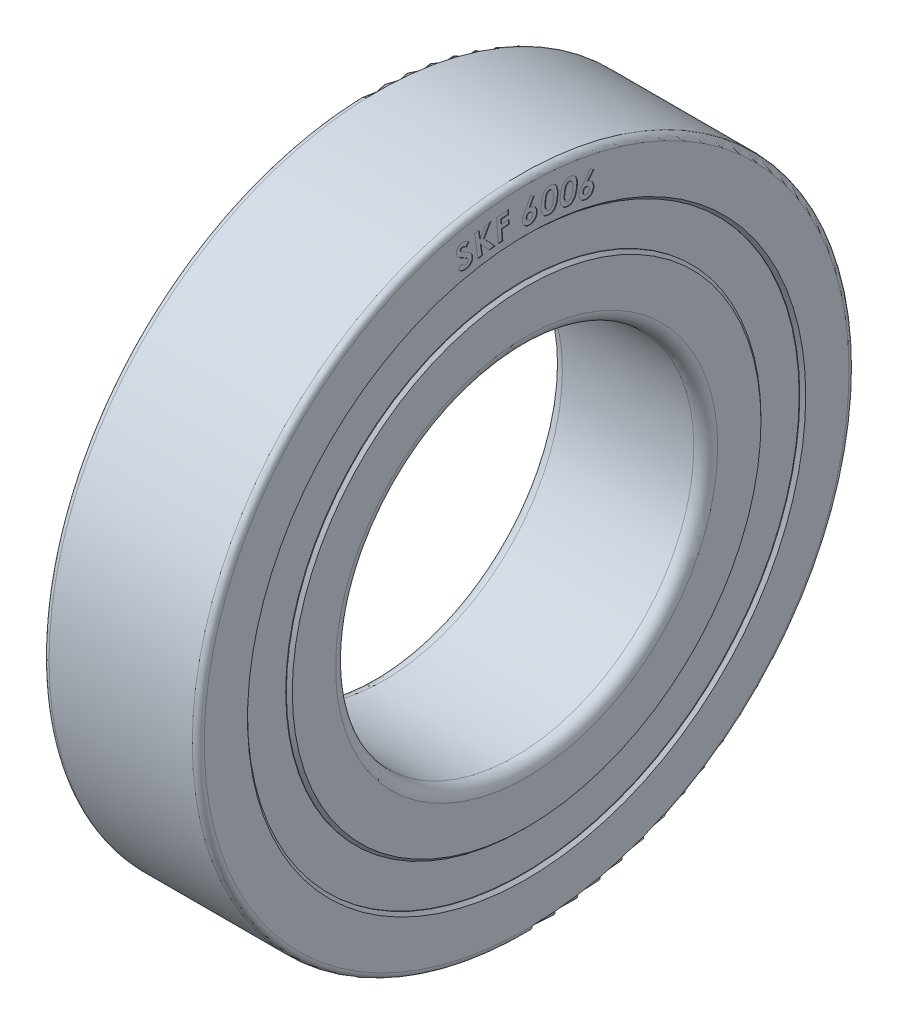
from build123d import *

# Parameters (mm, degrees)
CIRPATTERN1_COUNT = 12
WRAP1_START       = -0.05
WRAP1_DEPTH       = 0.05
SEAL_START        = 0.2
SKETCH4_R         = 23.125
SKETCH4_R_2       = 19.875
SEAL_1_DEPTH      = 0.2
SKETCH5_R         = 23.125
SKETCH5_R_2       = 19.875
SEAL_2_DEPTH      = 0.2


# Read off the part's stored shape, not the designer's step: Wrap1
with BuildPart() as part:
    # Sketch1 → Revolve1 (revolve)
    with BuildSketch(Plane.XY, mode=Mode.PRIVATE) as revolve1_sk:
        with BuildLine():
            Line((-12.75, 23.125), (-9.314582562, 23.125))
            ThreePointArc((-9.314582562, 23.125), (-6.5, 24.75), (-3.685417438, 23.125))
            Line((-3.685417438, 23.125), (-0.25, 23.125))
            Line((-0.25, 23.125), (0, 23.375))
            Line((0, 23.375), (0, 27))
            ThreePointArc((0, 27), (-0.146446609, 27.353553391), (-0.5, 27.5))
            Line((-0.5, 27.5), (-12.5, 27.5))
            ThreePointArc((-12.5, 27.5), (-12.853553391, 27.353553391), (-13, 27))
            Line((-13, 27), (-13, 23.375))
            Line((-13, 23.375), (-12.75, 23.125))
        make_face()
        with BuildLine():
            Line((-1, 15), (-12, 15))
            ThreePointArc((-12, 15), (-12.707106781, 15.292893219), (-13, 16))
            Line((-13, 16), (-13, 19.625))
            Line((-13, 19.625), (-12.75, 19.875))
            Line((-12.75, 19.875), (-9.314582562, 19.875))
            ThreePointArc((-9.314582562, 19.875), (-6.5, 18.25), (-3.685417438, 19.875))
            Line((-3.685417438, 19.875), (-0.25, 19.875))
            Line((-0.25, 19.875), (0, 19.625))
            Line((0, 19.625), (0, 16))
            ThreePointArc((0, 16), (-0.292893219, 15.292893219), (-1, 15))
        make_face()
    revolve(revolve1_sk.sketch.rotate(Axis((0, 0, 0), (-1, 0, 0)), 90), axis=Axis((0, 0, 0), (-1, 0, 0)))

    # Wrap1 outline → Wrap1 (cut)
    # profile 1 of 7: a face of its own
    with BuildSketch(Plane(origin=(0, 0, 0), x_dir=(0, 0, -1), z_dir=(1, 0, 0)).offset(WRAP1_START)):
        with BuildLine():
            add(Edge.make_bspline(
                [(5.156809449, 24.659470412), (5.176945196, 24.654630794), (5.216683196, 24.645079783), (5.273800642, 24.624532867), (5.327450546, 24.598685113), (5.377759061, 24.567953052), (5.423984453, 24.531360521), (5.467223707, 24.490457336), (5.506410953, 24.443954592), (5.542252088, 24.393541534), (5.573452736, 24.339721566), (5.598815277, 24.28364258), (5.617639321, 24.225802632), (5.631050214, 24.166681366), (5.638232871, 24.105853018), (5.639305794, 24.043477002), (5.634661519, 23.979452048), (5.626770551, 23.936789619), (5.622754962, 23.915079386)],
                knots=[0, 0, 0, 0, 0.06343411, 0.125187547, 0.185597165, 0.245685648, 0.305454076, 0.365957902, 0.427798083, 0.491506241, 0.55531949, 0.618153949, 0.679762089, 0.741424585, 0.803664384, 0.867115656, 0.932377267, 1, 1, 1, 1], degree=3))
            Line((5.156809449, 24.659470412), (5.636376757, 25.251617848))
            Line((5.636376757, 25.251617848), (5.353524193, 25.475576181))
            Line((5.353524193, 25.475576181), (4.646793424, 24.598172335))
            add(Edge.make_bspline(
                [(4.397194065, 24.167082591), (4.400716348, 24.182097626), (4.407769889, 24.212165952), (4.422364141, 24.256521919), (4.440632528, 24.300138418), (4.45817215, 24.33682558), (4.47581412, 24.366786938), (4.491471624, 24.392324213), (4.510451493, 24.42020006), (4.531989099, 24.450988806), (4.556419601, 24.484366968), (4.584319892, 24.519759583), (4.614127836, 24.558491206), (4.635631027, 24.584612606), (4.646793424, 24.598172335)],
                knots=[0, 0, 0, 0, 0.091866481, 0.183967018, 0.277804361, 0.373535642, 0.42594627, 0.484906716, 0.551999969, 0.626838199, 0.708803923, 0.798416397, 0.895357102, 1, 1, 1, 1], degree=3))
            add(Edge.make_bspline(
                [(4.886376757, 23.433108232), (4.86488432, 23.438149392), (4.82264709, 23.448056347), (4.762407125, 23.470117986), (4.705685758, 23.496483464), (4.653259679, 23.528628145), (4.604570018, 23.565864438), (4.560136337, 23.608351446), (4.519823014, 23.65618398), (4.483747718, 23.70810392), (4.452810851, 23.763110073), (4.426985014, 23.819182641), (4.407095886, 23.876035027), (4.393583518, 23.933406141), (4.385411928, 23.991211963), (4.383009383, 24.049445445), (4.38642109, 24.108436288), (4.393573645, 24.14737362), (4.397194065, 24.167082591)],
                knots=[0, 0, 0, 0, 0.067521584, 0.13269434, 0.195967516, 0.258716881, 0.320531129, 0.383275168, 0.44650607, 0.511712152, 0.576514605, 0.639443485, 0.700465924, 0.760554183, 0.819581779, 0.878908722, 0.938707034, 1, 1, 1, 1], degree=3))
            add(Edge.make_bspline(
                [(5.622754962, 23.915079386), (5.617811709, 23.894266192), (5.608111592, 23.853424586), (5.586901073, 23.794809674), (5.56097682, 23.739872833), (5.529788561, 23.688475545), (5.493636698, 23.640601495), (5.452108356, 23.596322661), (5.405395742, 23.55583481), (5.354412089, 23.519275177), (5.300517711, 23.487297504), (5.244485843, 23.461750343), (5.187630724, 23.441321174), (5.129486296, 23.427205191), (5.070091568, 23.419802886), (5.009721106, 23.417572577), (4.94811436, 23.422109661), (4.907157446, 23.429406147), (4.886376757, 23.433108232)],
                knots=[0, 0, 0, 0, 0.065474726, 0.128480662, 0.190503126, 0.251250123, 0.312276008, 0.373912903, 0.436823179, 0.501297602, 0.56583427, 0.62842462, 0.689614767, 0.750625572, 0.811251274, 0.872637954, 0.935379139, 1, 1, 1, 1], degree=3))
        make_face()
        with BuildLine():
            add(Edge.make_bspline(
                [(4.76257868, 24.10017554), (4.759549874, 24.081932639), (4.753640176, 24.046337757), (4.757717615, 23.992727341), (4.771496454, 23.941689124), (4.79512902, 23.894556693), (4.825995327, 23.853033892), (4.862952192, 23.819362773), (4.905539492, 23.794830769), (4.936740558, 23.786346938), (4.952482526, 23.782066566)],
                knots=[0, 0, 0, 0, 0.134611772, 0.262649572, 0.388964099, 0.518478568, 0.645240174, 0.764683635, 0.881275122, 1, 1, 1, 1], degree=3))
            add(Edge.make_bspline(
                [(5.061857526, 24.312114642), (5.044938896, 24.31470635), (5.011931928, 24.319762575), (4.962091225, 24.31501682), (4.914657141, 24.299896573), (4.871007142, 24.274382268), (4.831852796, 24.241335895), (4.800309559, 24.200406831), (4.775830431, 24.153100777), (4.767087649, 24.118183593), (4.76257868, 24.10017554)],
                knots=[0, 0, 0, 0, 0.125139085, 0.244136899, 0.363388367, 0.487542393, 0.612577952, 0.736789911, 0.864253055, 1, 1, 1, 1], degree=3))
            add(Edge.make_bspline(
                [(5.260174834, 23.996409514), (5.263143257, 24.014646012), (5.268933742, 24.050219846), (5.265729915, 24.103521738), (5.251497752, 24.15361514), (5.228413397, 24.19995723), (5.196938153, 24.240664295), (5.158385861, 24.274215926), (5.112700103, 24.29869709), (5.07905507, 24.307576144), (5.061857526, 24.312114642)],
                knots=[0, 0, 0, 0, 0.132913819, 0.259274248, 0.381210729, 0.506076807, 0.630291616, 0.749759049, 0.872090197, 1, 1, 1, 1], degree=3))
            add(Edge.make_bspline(
                [(4.952482526, 23.782066566), (4.969398672, 23.779489709), (5.002664515, 23.774422283), (5.053070421, 23.779103493), (5.101388165, 23.794617554), (5.147106023, 23.81921098), (5.187912011, 23.852753141), (5.221506369, 23.894018976), (5.246447775, 23.942531293), (5.255521172, 23.978144056), (5.260174834, 23.996409514)],
                knots=[0, 0, 0, 0, 0.122580403, 0.241056127, 0.359698764, 0.485041303, 0.611811326, 0.736624029, 0.864916891, 1, 1, 1, 1], degree=3))
        make_face(mode=Mode.SUBTRACT)
    # profile 2 of 7: a face of its own
    with BuildSketch(Plane(origin=(0, 0, 0), x_dir=(0, 0, -1), z_dir=(1, 0, 0)).offset(WRAP1_START)):
        with BuildLine():
            add(Edge.make_bspline(
                [(4.222788326, 24.633161259), (4.218103895, 24.601334141), (4.209002473, 24.539496962), (4.191520184, 24.450189395), (4.172732829, 24.366674893), (4.152572384, 24.288732639), (4.129795072, 24.216663892), (4.104963053, 24.150502993), (4.078638836, 24.090028627), (4.05002572, 24.03527246), (4.019745907, 23.98543707), (3.988608642, 23.939463816), (3.955560792, 23.897774095), (3.921618432, 23.859607032), (3.886300624, 23.825238976), (3.849229057, 23.795248093), (3.811166903, 23.768452133), (3.771198014, 23.74604567), (3.729895196, 23.726970659), (3.686566511, 23.712269908), (3.641615247, 23.700515032), (3.594559125, 23.692531322), (3.545528249, 23.688335422), (3.494528655, 23.686926158), (3.44166216, 23.689937881), (3.405994045, 23.694262793), (3.387852429, 23.696462541)],
                knots=[0, 0, 0, 0, 0.067714815, 0.131563696, 0.19151489, 0.247909011, 0.300990698, 0.350545378, 0.39661787, 0.439749571, 0.480491447, 0.519325277, 0.556558946, 0.592397272, 0.626794024, 0.660164401, 0.692685508, 0.724662516, 0.756492116, 0.788321715, 0.820847682, 0.85421806, 0.888656149, 0.924370757, 0.961533244, 1, 1, 1, 1], degree=3))
            add(Edge.make_bspline(
                [(3.672307557, 25.767776643), (3.689979699, 25.764935831), (3.724606593, 25.759369526), (3.775086515, 25.747202192), (3.823305884, 25.731999402), (3.869229483, 25.71362768), (3.912849991, 25.692355652), (3.953922188, 25.667722936), (3.992735971, 25.640087161), (4.029417369, 25.609533827), (4.063437706, 25.575992036), (4.094624327, 25.539076461), (4.12295823, 25.498881677), (4.149077667, 25.455769444), (4.171950827, 25.409140836), (4.192296924, 25.359621043), (4.210006479, 25.306769535), (4.224899659, 25.250465775), (4.236485929, 25.189960493), (4.244756757, 25.124929664), (4.249971406, 25.054994824), (4.251440081, 24.980108056), (4.249211181, 24.90032421), (4.244027985, 24.815591977), (4.235117077, 24.725949406), (4.226973088, 24.664656443), (4.222788326, 24.633161259)],
                knots=[0, 0, 0, 0, 0.037500854, 0.073479381, 0.108708766, 0.143374426, 0.177045109, 0.210308526, 0.243624888, 0.276808142, 0.31025474, 0.343618092, 0.377943128, 0.413222506, 0.449145471, 0.486671382, 0.525348599, 0.56587719, 0.608636666, 0.654356668, 0.703191605, 0.755541231, 0.811255028, 0.870421793, 0.93341667, 1, 1, 1, 1], degree=3))
            add(Edge.make_bspline(
                [(3.115817172, 25.573866387), (3.134630755, 25.59288433), (3.171475134, 25.630128925), (3.232927576, 25.677364978), (3.297981533, 25.715382079), (3.366469009, 25.744526241), (3.438465901, 25.76415732), (3.513654408, 25.775024355), (3.592257091, 25.776696786), (3.645236394, 25.770793223), (3.672307557, 25.767776643)],
                knots=[0, 0, 0, 0, 0.130435546, 0.25544399, 0.376944441, 0.497262836, 0.617582995, 0.740072205, 0.867183081, 1, 1, 1, 1], degree=3))
            add(Edge.make_bspline(
                [(2.836169736, 24.811446515), (2.842842937, 24.855052489), (2.855729524, 24.939259784), (2.880913568, 25.059905225), (2.910198575, 25.17046734), (2.942601595, 25.271172228), (2.979378033, 25.36182417), (3.020223706, 25.442319097), (3.064626532, 25.513295863), (3.099186578, 25.554188496), (3.115817172, 25.573866387)],
                knots=[0, 0, 0, 0, 0.160762233, 0.310447206, 0.448937925, 0.577465339, 0.695784432, 0.805062753, 0.906194499, 1, 1, 1, 1], degree=3))
            add(Edge.make_bspline(
                [(3.387852429, 23.696462541), (3.369773675, 23.699273732), (3.334180227, 23.704808405), (3.282573231, 23.717429147), (3.233538246, 23.732535125), (3.187252591, 23.750708692), (3.143404247, 23.771375272), (3.102476375, 23.795531964), (3.064240984, 23.822564382), (3.028350381, 23.852172286), (2.995485916, 23.885157318), (2.965294892, 23.921232462), (2.937078402, 23.959977289), (2.912059295, 24.002294266), (2.888923143, 24.047231904), (2.869254344, 24.095564442), (2.850948524, 24.146477591), (2.835652648, 24.200923728), (2.823601342, 24.259684889), (2.814871153, 24.323249957), (2.809907411, 24.392159045), (2.807888461, 24.466088389), (2.809650033, 24.5452263), (2.814959026, 24.62941593), (2.823860849, 24.718789393), (2.831985776, 24.779951084), (2.836169736, 24.811446515)],
                knots=[0, 0, 0, 0, 0.038776683, 0.076343526, 0.112525328, 0.147492348, 0.181688474, 0.21519657, 0.248113222, 0.280887073, 0.313723247, 0.346678848, 0.380549873, 0.415222157, 0.450806259, 0.487616364, 0.52576771, 0.565479077, 0.607406049, 0.65285656, 0.701415724, 0.753818463, 0.809611427, 0.86918773, 0.932637753, 1, 1, 1, 1], degree=3))
        make_face()
        with BuildLine():
            add(Edge.make_bspline(
                [(3.209967813, 24.750148438), (3.206038298, 24.72012328), (3.198506222, 24.662571185), (3.19067907, 24.579334347), (3.187041652, 24.502861742), (3.186854597, 24.433193366), (3.190202128, 24.370269041), (3.197478485, 24.314175206), (3.209061592, 24.264779432), (3.224197791, 24.221710248), (3.243104044, 24.184627441), (3.263323929, 24.151576672), (3.286866919, 24.123476957), (3.312198502, 24.099193814), (3.339620768, 24.078782052), (3.369629572, 24.063045038), (3.402058692, 24.051633565), (3.424770052, 24.047516457), (3.436329993, 24.045420874)],
                knots=[0, 0, 0, 0, 0.110466733, 0.211742157, 0.304901605, 0.389675313, 0.465805708, 0.53463972, 0.595734944, 0.650596935, 0.700710438, 0.747344912, 0.791635055, 0.83402191, 0.875143877, 0.915897655, 0.957192429, 1, 1, 1, 1], degree=3))
            add(Edge.make_bspline(
                [(3.63064089, 25.410404849), (3.615023095, 25.411926066), (3.584381425, 25.414910651), (3.53844037, 25.409248141), (3.494299443, 25.395810433), (3.459120092, 25.378249622), (3.432518163, 25.359546677), (3.412738243, 25.342695645), (3.394008706, 25.322512348), (3.375991911, 25.299463984), (3.358342422, 25.273846921), (3.341452589, 25.24521474), (3.325553545, 25.213562702), (3.310288974, 25.178756518), (3.29525197, 25.140506721), (3.28147802, 25.09786425), (3.26774503, 25.051028337), (3.255105218, 24.999503203), (3.242611627, 24.943571667), (3.231223981, 24.882987004), (3.219826801, 24.818122925), (3.2133215, 24.773271005), (3.209967813, 24.750148438)],
                knots=[0, 0, 0, 0, 0.053892691, 0.105735932, 0.15810057, 0.212181232, 0.240244049, 0.269918017, 0.301470421, 0.334862094, 0.370572829, 0.408502771, 0.449217715, 0.492448613, 0.539325576, 0.590652421, 0.64667437, 0.707339978, 0.773271065, 0.843969569, 0.919561436, 1, 1, 1, 1], degree=3))
            add(Edge.make_bspline(
                [(3.848188967, 24.682440105), (3.852441197, 24.713527737), (3.860619857, 24.773321119), (3.868462471, 24.859816664), (3.873194734, 24.939185588), (3.873788878, 25.011413853), (3.870310666, 25.076454674), (3.863298526, 25.134331676), (3.852864307, 25.185333526), (3.837910818, 25.229441173), (3.819829124, 25.267720498), (3.800140772, 25.301618188), (3.777267903, 25.330598674), (3.753013177, 25.356116515), (3.725319745, 25.375890889), (3.696138625, 25.392504277), (3.664295812, 25.404191756), (3.641935996, 25.40831964), (3.63064089, 25.410404849)],
                knots=[0, 0, 0, 0, 0.111971755, 0.21536442, 0.309882869, 0.395677761, 0.473011038, 0.542180024, 0.603598872, 0.658463212, 0.707931901, 0.75452486, 0.79800029, 0.839456223, 0.87968568, 0.918943407, 0.959054102, 1, 1, 1, 1], degree=3))
            add(Edge.make_bspline(
                [(3.672708198, 24.149587541), (3.682772855, 24.162999274), (3.703974756, 24.191252022), (3.73076494, 24.240186193), (3.755377827, 24.296258406), (3.778704575, 24.3591872), (3.799268203, 24.429683824), (3.818073104, 24.507340606), (3.83426159, 24.592451058), (3.843430564, 24.651694604), (3.848188967, 24.682440105)],
                knots=[0, 0, 0, 0, 0.088652719, 0.186753123, 0.294325915, 0.412620836, 0.541652836, 0.682735355, 0.835349824, 1, 1, 1, 1], degree=3))
            add(Edge.make_bspline(
                [(3.436329993, 24.045420874), (3.447533845, 24.044133056), (3.469524586, 24.041605347), (3.50234017, 24.043904259), (3.533900971, 24.050275585), (3.564263328, 24.061231484), (3.593390222, 24.076785695), (3.621485932, 24.096420747), (3.648304937, 24.120893132), (3.664367826, 24.139780571), (3.672708198, 24.149587541)],
                knots=[0, 0, 0, 0, 0.124475809, 0.244319115, 0.36190293, 0.479616497, 0.599841326, 0.726022362, 0.857741932, 1, 1, 1, 1], degree=3))
        make_face(mode=Mode.SUBTRACT)
    # profile 3 of 7: a face of its own
    with BuildSketch(Plane(origin=(0, 0, 0), x_dir=(0, 0, -1), z_dir=(1, 0, 0)).offset(WRAP1_START)):
        with BuildLine():
            add(Edge.make_bspline(
                [(2.615925126, 24.856947901), (2.61321344, 24.824873409), (2.60793947, 24.76249158), (2.596507138, 24.671939746), (2.583588208, 24.587017083), (2.567968552, 24.507876046), (2.550047014, 24.434442251), (2.529707336, 24.36659213), (2.507005277, 24.304488871), (2.481922956, 24.247831588), (2.454970921, 24.196025191), (2.426583418, 24.148191027), (2.396407538, 24.104336811), (2.364750849, 24.064126193), (2.331432194, 24.027550735), (2.296624193, 23.994554404), (2.260054305, 23.965543416), (2.221754458, 23.940599872), (2.181675692, 23.919165458), (2.139521756, 23.90098281), (2.095013592, 23.886847572), (2.048497579, 23.87531884), (1.999815877, 23.867898868), (1.948935863, 23.864013447), (1.895939725, 23.86311832), (1.859909129, 23.86513267), (1.841486023, 23.866162645)],
                knots=[0, 0, 0, 0, 0.067606638, 0.131488466, 0.1916745, 0.248009097, 0.300873201, 0.350392415, 0.396719556, 0.439670917, 0.4804475, 0.51931927, 0.556434704, 0.592183998, 0.626734461, 0.66027135, 0.692822344, 0.724644785, 0.75614537, 0.788190817, 0.820925022, 0.854127053, 0.888762819, 0.924219257, 0.961251913, 1, 1, 1, 1], degree=3))
            add(Edge.make_bspline(
                [(1.991726408, 25.956306875), (2.009527753, 25.954731891), (2.04463996, 25.951625317), (2.095920643, 25.941937665), (2.145376796, 25.930380272), (2.192330502, 25.914371205), (2.237337497, 25.896150982), (2.280165177, 25.874409936), (2.320509042, 25.848967642), (2.359174537, 25.821017244), (2.395444929, 25.789591726), (2.429074875, 25.754716081), (2.46012053, 25.716343956), (2.488500279, 25.674579049), (2.514529817, 25.629558933), (2.538373534, 25.581353744), (2.558930857, 25.529506973), (2.577684335, 25.474254845), (2.593169472, 25.414656174), (2.606101016, 25.350216233), (2.615468804, 25.280624052), (2.621870544, 25.205750075), (2.624805832, 25.125806336), (2.625246744, 25.04068981), (2.62243918, 24.950484577), (2.618137808, 24.888720273), (2.615925126, 24.856947901)],
                knots=[0, 0, 0, 0, 0.037346011, 0.073663019, 0.109018191, 0.143458287, 0.177269965, 0.210490656, 0.243732466, 0.276910876, 0.310169104, 0.343940396, 0.378089431, 0.413254401, 0.449416475, 0.486758309, 0.525598746, 0.56595557, 0.608696065, 0.654261591, 0.703311862, 0.755444967, 0.811340474, 0.870543027, 0.933405626, 1, 1, 1, 1], degree=3))
            add(Edge.make_bspline(
                [(1.447655895, 25.726338927), (1.465219697, 25.746682176), (1.499621517, 25.786528035), (1.558217953, 25.837714898), (1.620935, 25.879759109), (1.687466835, 25.913402724), (1.758096115, 25.937875956), (1.832623618, 25.953672434), (1.911122784, 25.960026064), (1.964484471, 25.957563865), (1.991726408, 25.956306875)],
                knots=[0, 0, 0, 0, 0.130703787, 0.256006528, 0.377346277, 0.497413401, 0.617888104, 0.740157646, 0.867346608, 1, 1, 1, 1], degree=3))
            add(Edge.make_bspline(
                [(1.217287305, 24.945088927), (1.221172404, 24.98920029), (1.228666856, 25.074292206), (1.245775531, 25.196689606), (1.267760326, 25.309161628), (1.293876877, 25.412067193), (1.3249296, 25.505230834), (1.360559203, 25.588497772), (1.400089583, 25.662567935), (1.432173348, 25.705581855), (1.447655895, 25.726338927)],
                knots=[0, 0, 0, 0, 0.16089076, 0.310362278, 0.448834839, 0.577126543, 0.695902148, 0.805244503, 0.906017543, 1, 1, 1, 1], degree=3))
            add(Edge.make_bspline(
                [(1.841486023, 23.866162645), (1.82316421, 23.867954228), (1.787183194, 23.871472602), (1.734682315, 23.880252002), (1.68471647, 23.892234481), (1.637288406, 23.907666036), (1.591988544, 23.9254417), (1.549300248, 23.946688739), (1.509543591, 23.971537832), (1.47149932, 23.998467696), (1.436819122, 24.029827499), (1.403571514, 24.063424366), (1.373288081, 24.100695599), (1.345488337, 24.141344395), (1.319490756, 24.184674905), (1.296097656, 24.231572155), (1.275603932, 24.281681454), (1.25631492, 24.334947858), (1.240221592, 24.392755165), (1.227566205, 24.455832633), (1.218065264, 24.524339504), (1.211900254, 24.598169088), (1.208231664, 24.677285047), (1.208014806, 24.761750123), (1.210771789, 24.851684719), (1.215070971, 24.913316316), (1.217287305, 24.945088927)],
                knots=[0, 0, 0, 0, 0.038945147, 0.076481836, 0.112532974, 0.147564076, 0.181934742, 0.215424036, 0.248283888, 0.28106832, 0.313898997, 0.347070851, 0.381010163, 0.415342473, 0.451204842, 0.487853505, 0.526110822, 0.565705651, 0.607666047, 0.652943651, 0.701738852, 0.753930225, 0.809657024, 0.869282583, 0.932611944, 1, 1, 1, 1], degree=3))
        make_face()
        with BuildLine():
            add(Edge.make_bspline(
                [(1.595492433, 24.908229952), (1.593419867, 24.878059308), (1.589433516, 24.820029401), (1.586938353, 24.736371633), (1.587874638, 24.659613624), (1.592807588, 24.589973191), (1.599937274, 24.527250933), (1.611043187, 24.47158271), (1.62559935, 24.422903534), (1.643824014, 24.380893034), (1.664984313, 24.344885691), (1.687843635, 24.31351407), (1.712357919, 24.286115235), (1.739412563, 24.26357523), (1.768484044, 24.245242073), (1.799746702, 24.231703766), (1.83277509, 24.221568423), (1.85583773, 24.219150871), (1.86752769, 24.217925465)],
                knots=[0, 0, 0, 0, 0.110036016, 0.211642145, 0.304470715, 0.389227473, 0.465596425, 0.534024478, 0.595512482, 0.650134176, 0.700225118, 0.74717185, 0.791203636, 0.833637703, 0.87489799, 0.915801884, 0.95732177, 1, 1, 1, 1], degree=3))
            add(Edge.make_bspline(
                [(1.97329692, 25.595729952), (1.957634342, 25.596362366), (1.926717249, 25.597610715), (1.881164636, 25.588427534), (1.83766573, 25.572437541), (1.80396198, 25.55214135), (1.778212808, 25.532124426), (1.760090107, 25.513468163), (1.742071138, 25.492653013), (1.725961204, 25.468213557), (1.709748504, 25.441571152), (1.695092945, 25.411678966), (1.681059105, 25.37918805), (1.667787477, 25.343635852), (1.655122914, 25.304425492), (1.644280449, 25.260836458), (1.633732041, 25.212895874), (1.624341918, 25.160612228), (1.615340745, 25.103880478), (1.607993997, 25.042643366), (1.601110298, 24.976935032), (1.597404103, 24.931609188), (1.595492433, 24.908229952)],
                knots=[0, 0, 0, 0, 0.053682663, 0.105966707, 0.15837944, 0.212281265, 0.240371022, 0.27021942, 0.301473533, 0.334816656, 0.370619802, 0.408580563, 0.449066612, 0.492188951, 0.538912688, 0.590548473, 0.646436817, 0.707543439, 0.773020684, 0.843760314, 0.919410998, 1, 1, 1, 1], degree=3))
            add(Edge.make_bspline(
                [(2.238120638, 24.881787645), (2.240374566, 24.913158179), (2.244706346, 24.973448615), (2.246943068, 25.060458877), (2.246510067, 25.140132185), (2.242156268, 25.212349832), (2.234717715, 25.277128924), (2.224196101, 25.334684445), (2.210095286, 25.384997287), (2.192061543, 25.428150976), (2.172014841, 25.465559447), (2.149344386, 25.497669437), (2.12529461, 25.525878765), (2.098809061, 25.549146655), (2.070370278, 25.56794578), (2.039882302, 25.582115972), (2.007365568, 25.592002668), (1.984713521, 25.594480918), (1.97329692, 25.595729952)],
                knots=[0, 0, 0, 0, 0.111977085, 0.215206642, 0.309841992, 0.395597165, 0.472688859, 0.541891211, 0.603748573, 0.658324893, 0.708117274, 0.75455399, 0.798035788, 0.839817578, 0.879648758, 0.91900591, 0.959179092, 1, 1, 1, 1], degree=3))
            add(Edge.make_bspline(
                [(2.097094997, 24.337717132), (2.106234322, 24.35182214), (2.125453402, 24.381483554), (2.148975477, 24.432158113), (2.170694105, 24.489553935), (2.189103145, 24.554254033), (2.205696194, 24.625878711), (2.218873531, 24.704735589), (2.230244932, 24.790784096), (2.235425492, 24.850645313), (2.238120638, 24.881787645)],
                knots=[0, 0, 0, 0, 0.088697286, 0.186521474, 0.29436547, 0.41269631, 0.541568332, 0.682611803, 0.834881268, 1, 1, 1, 1], degree=3))
            add(Edge.make_bspline(
                [(1.86752769, 24.217925465), (1.878753477, 24.217473378), (1.90088554, 24.216582072), (1.933547531, 24.220765689), (1.964737485, 24.229170116), (1.994372295, 24.242258491), (2.022447816, 24.259623157), (2.049279497, 24.281217551), (2.074590747, 24.307323704), (2.08944266, 24.327382162), (2.097094997, 24.337717132)],
                knots=[0, 0, 0, 0, 0.123779985, 0.244036908, 0.361637656, 0.479081375, 0.600130061, 0.724853612, 0.858232886, 1, 1, 1, 1], degree=3))
        make_face(mode=Mode.SUBTRACT)
    # profile 4 of 7: a face of its own
    with BuildSketch(Plane(origin=(0, 0, 0), x_dir=(0, 0, -1), z_dir=(1, 0, 0)).offset(WRAP1_START)):
        with BuildLine():
            add(Edge.make_bspline(
                [(0.291411535, 25.18708512), (0.312148104, 25.186308958), (0.352888728, 25.184784051), (0.412725092, 25.175203105), (0.470107617, 25.160580867), (0.525090534, 25.139832076), (0.577674836, 25.113840029), (0.62781556, 25.081910813), (0.674975817, 25.043925955), (0.719767401, 25.001415246), (0.760122265, 24.954373131), (0.79629228, 24.904738062), (0.825883764, 24.85169251), (0.850616929, 24.796443583), (0.868930347, 24.738152972), (0.882224952, 24.677444808), (0.890013847, 24.613840368), (0.890515228, 24.570520118), (0.890770509, 24.548463325)],
                knots=[0, 0, 0, 0, 0.063712171, 0.125173721, 0.185786933, 0.245390216, 0.305400352, 0.365733716, 0.4276416, 0.491204266, 0.555209138, 0.617843092, 0.679583468, 0.741498151, 0.80353103, 0.866957115, 0.932260329, 1, 1, 1, 1], degree=3))
            Line((0.291411535, 25.18708512), (0.647180765, 25.859360761))
            Line((0.647180765, 25.859360761), (0.327469227, 26.024424863))
            Line((0.327469227, 26.024424863), (-0.195767953, 25.029633197))
            add(Edge.make_bspline(
                [(-0.357226286, 24.559681274), (-0.356644374, 24.575054733), (-0.355477051, 24.605894118), (-0.349708102, 24.652237162), (-0.340574377, 24.698591743), (-0.329630265, 24.737601997), (-0.31854345, 24.770495643), (-0.307620336, 24.798334284), (-0.294777035, 24.829373409), (-0.279471774, 24.863404993), (-0.261829386, 24.900666106), (-0.241785941, 24.940930673), (-0.219732993, 24.984396786), (-0.20396184, 25.014166414), (-0.195767953, 25.029633197)],
                knots=[0, 0, 0, 0, 0.091871355, 0.184295283, 0.278641223, 0.373873502, 0.426097173, 0.485953161, 0.552477122, 0.626757907, 0.708837919, 0.798748528, 0.895439984, 1, 1, 1, 1], degree=3))
            add(Edge.make_bspline(
                [(0.262565381, 23.935482556), (0.240625763, 23.936234279), (0.197338858, 23.937717429), (0.134036519, 23.947676791), (0.073519943, 23.962661815), (0.016089127, 23.984224646), (-0.038458984, 24.011441298), (-0.090046371, 24.044631535), (-0.138883986, 24.083294726), (-0.18389686, 24.127499242), (-0.225029921, 24.175152175), (-0.260527912, 24.2254406), (-0.29159979, 24.276780152), (-0.315834291, 24.330296227), (-0.335072324, 24.385222702), (-0.347987514, 24.441949036), (-0.356588718, 24.500254054), (-0.357012467, 24.539751394), (-0.357226286, 24.559681274)],
                knots=[0, 0, 0, 0, 0.06734365, 0.132869139, 0.196314253, 0.258459609, 0.320803476, 0.383131162, 0.446460908, 0.511699705, 0.576540449, 0.639456057, 0.700491865, 0.760485912, 0.819483933, 0.878858307, 0.938873366, 1, 1, 1, 1], degree=3))
            add(Edge.make_bspline(
                [(0.890770509, 24.548463325), (0.889976872, 24.5271981), (0.888417128, 24.4854053), (0.879094201, 24.424004287), (0.863624949, 24.365358355), (0.84335785, 24.3087736), (0.816637444, 24.255122647), (0.78482853, 24.203685174), (0.746967823, 24.155186518), (0.703886307, 24.109871424), (0.65707656, 24.068600639), (0.607593296, 24.032156307), (0.555709695, 24.001713949), (0.501676936, 23.976355949), (0.444904786, 23.9578898), (0.386143045, 23.943937791), (0.325004573, 23.936297126), (0.283551984, 23.935756343), (0.262565381, 23.935482556)],
                knots=[0, 0, 0, 0, 0.065324149, 0.128382331, 0.190264872, 0.251382752, 0.31265323, 0.374003292, 0.436853007, 0.501266752, 0.565784895, 0.628301772, 0.689716249, 0.75027965, 0.811244551, 0.872734322, 0.935567973, 1, 1, 1, 1], degree=3))
        make_face()
        with BuildLine():
            add(Edge.make_bspline(
                [(0.013366663, 24.564889607), (0.013957976, 24.54636687), (0.015111158, 24.510243695), (0.029374479, 24.458391492), (0.052538274, 24.411021983), (0.084546818, 24.369249836), (0.122793076, 24.334755415), (0.165425906, 24.309074356), (0.211661709, 24.293105069), (0.243879572, 24.290809391), (0.260161535, 24.289649222)],
                knots=[0, 0, 0, 0, 0.135186379, 0.263641458, 0.389922987, 0.518897229, 0.646206449, 0.764506131, 0.880988305, 1, 1, 1, 1], degree=3))
            add(Edge.make_bspline(
                [(0.265770509, 24.829312684), (0.248696721, 24.828765379), (0.215383837, 24.827697525), (0.167799993, 24.812733569), (0.124356207, 24.789098102), (0.086198467, 24.756189282), (0.054475001, 24.716075234), (0.030853797, 24.670165189), (0.016478007, 24.619013375), (0.01442377, 24.583278641), (0.013366663, 24.564889607)],
                knots=[0, 0, 0, 0, 0.125199432, 0.244278191, 0.363027997, 0.487107669, 0.61235338, 0.737181965, 0.864754278, 1, 1, 1, 1], degree=3))
            add(Edge.make_bspline(
                [(0.52017756, 24.558479351), (0.519501317, 24.576978428), (0.5181897, 24.612858599), (0.505281782, 24.664621321), (0.481797441, 24.711008449), (0.450051225, 24.751718605), (0.411887028, 24.786161852), (0.367337322, 24.810854789), (0.318062765, 24.826420698), (0.28351629, 24.828331266), (0.265770509, 24.829312684)],
                knots=[0, 0, 0, 0, 0.133531098, 0.258992296, 0.381998195, 0.506509268, 0.63025499, 0.750801937, 0.871992319, 1, 1, 1, 1], degree=3))
            add(Edge.make_bspline(
                [(0.260161535, 24.289649222), (0.277212341, 24.29043699), (0.31068866, 24.291983637), (0.359181371, 24.306075536), (0.403590604, 24.33040375), (0.443401837, 24.363632855), (0.476934268, 24.404148083), (0.502053037, 24.450866459), (0.517223902, 24.503070769), (0.519175519, 24.539681745), (0.52017756, 24.558479351)],
                knots=[0, 0, 0, 0, 0.122637376, 0.24077734, 0.360016813, 0.485042179, 0.612163467, 0.736550565, 0.864734041, 1, 1, 1, 1], degree=3))
        make_face(mode=Mode.SUBTRACT)
    # profile 5 of 7: a face of its own
    with BuildSketch(Plane(origin=(0, 0, 0), x_dir=(0, 0, -1), z_dir=(1, 0, 0)).offset(WRAP1_START)):
        with BuildLine():
            add(Edge.make_bspline(
                [(-5.035420044, 24.963520892), (-5.050732952, 24.976954515), (-5.08004337, 25.002667795), (-5.125114874, 25.036360912), (-5.169346864, 25.063239874), (-5.212146508, 25.084631369), (-5.25428166, 25.098741811), (-5.29502711, 25.107058388), (-5.334896084, 25.109147894), (-5.360508125, 25.104995329), (-5.373160428, 25.102943969)],
                knots=[0, 0, 0, 0, 0.161173842, 0.308502637, 0.444624479, 0.570355362, 0.686326252, 0.795141844, 0.898800423, 1, 1, 1, 1], degree=3))
            Line((-5.035420044, 24.963520892), (-4.812262993, 25.264802944))
            add(Edge.make_bspline(
                [(-5.442871967, 25.459514482), (-5.418641336, 25.463922475), (-5.3704528, 25.472688848), (-5.296756993, 25.473938662), (-5.223179731, 25.467889534), (-5.162000039, 25.45462192), (-5.112613376, 25.4391763), (-5.073687132, 25.424454839), (-5.033747368, 25.40558833), (-4.991690148, 25.384592969), (-4.948884813, 25.359065713), (-4.904120472, 25.331156839), (-4.858508932, 25.299273654), (-4.827960531, 25.276503545), (-4.812262993, 25.264802944)],
                knots=[0, 0, 0, 0, 0.107960487, 0.214705837, 0.322406522, 0.431533978, 0.48864854, 0.549515672, 0.614050385, 0.682485973, 0.755791195, 0.832729556, 0.914046757, 1, 1, 1, 1], degree=3))
            add(Edge.make_bspline(
                [(-5.874362351, 24.851742046), (-5.877342719, 24.868524222), (-5.883225902, 24.901651894), (-5.886582064, 24.951490788), (-5.88387958, 25.000473627), (-5.876945878, 25.048780876), (-5.863870517, 25.096289903), (-5.845620674, 25.142868229), (-5.822780755, 25.188959126), (-5.794318774, 25.233219294), (-5.762292257, 25.275671062), (-5.726013303, 25.314013768), (-5.686997087, 25.348979168), (-5.644334775, 25.379210215), (-5.598859226, 25.406173981), (-5.549660189, 25.427719494), (-5.497798034, 25.446827977), (-5.461415674, 25.455231364), (-5.442871967, 25.459514482)],
                knots=[0, 0, 0, 0, 0.061627211, 0.121650849, 0.180172601, 0.23878798, 0.297847541, 0.357950821, 0.419519315, 0.483576796, 0.54801925, 0.611584895, 0.674205597, 0.737210792, 0.800424892, 0.865069803, 0.931227497, 1, 1, 1, 1], degree=3))
            add(Edge.make_bspline(
                [(-5.224923249, 24.275620251), (-5.254774855, 24.291113551), (-5.312213226, 24.320924673), (-5.39379644, 24.365959911), (-5.468033282, 24.407951445), (-5.533839795, 24.44882841), (-5.592304877, 24.486384049), (-5.642717822, 24.522195352), (-5.685437115, 24.555685896), (-5.731114404, 24.597026199), (-5.777669488, 24.648986883), (-5.82230752, 24.713711067), (-5.855669029, 24.781167935), (-5.868172652, 24.828373673), (-5.874362351, 24.851742046)],
                knots=[0, 0, 0, 0, 0.11248024, 0.216426602, 0.311660039, 0.397687946, 0.475488898, 0.544026441, 0.60443529, 0.65692411, 0.749915872, 0.837008568, 0.919313948, 1, 1, 1, 1], degree=3))
            add(Edge.make_bspline(
                [(-4.887984146, 23.996373456), (-4.890900942, 24.007350088), (-4.896849766, 24.029736998), (-4.914133889, 24.061179365), (-4.936711082, 24.0914476), (-4.960787616, 24.11519585), (-4.984195673, 24.134412416), (-5.006466438, 24.150299072), (-5.032462937, 24.168096261), (-5.063067225, 24.186629912), (-5.097454524, 24.207286495), (-5.136430851, 24.228634332), (-5.17915964, 24.252002537), (-5.209263683, 24.267538652), (-5.224923249, 24.275620251)],
                knots=[0, 0, 0, 0, 0.075306255, 0.15358758, 0.236737969, 0.325937134, 0.377691067, 0.438105863, 0.5078348, 0.587217324, 0.67603968, 0.774663293, 0.882784019, 1, 1, 1, 1], degree=3))
            add(Edge.make_bspline(
                [(-5.074282223, 23.764001662), (-5.059138689, 23.767874888), (-5.029552071, 23.775442188), (-4.989268699, 23.795515699), (-4.953809132, 23.821065439), (-4.924986198, 23.852689243), (-4.902616953, 23.887203105), (-4.888439981, 23.923411942), (-4.882480497, 23.960300255), (-4.886152871, 23.984370517), (-4.887984146, 23.996373456)],
                knots=[0, 0, 0, 0, 0.141988902, 0.277410221, 0.407051529, 0.537856835, 0.664701771, 0.779425614, 0.890007802, 1, 1, 1, 1], degree=3))
            add(Edge.make_bspline(
                [(-5.453288634, 23.953905508), (-5.437243226, 23.936046312), (-5.406544812, 23.901877721), (-5.358555572, 23.856448262), (-5.310147932, 23.8201361), (-5.262474933, 23.791674011), (-5.21496972, 23.771362197), (-5.167605269, 23.760004836), (-5.120283864, 23.756593627), (-5.08960015, 23.761534886), (-5.074282223, 23.764001662)],
                knots=[0, 0, 0, 0, 0.161762381, 0.309487221, 0.444481, 0.568730696, 0.682887162, 0.791155576, 0.895740669, 1, 1, 1, 1], degree=3))
            Line((-5.453288634, 23.953905508), (-5.724923249, 23.699097815))
            add(Edge.make_bspline(
                [(-5.007375172, 23.409033713), (-5.024569763, 23.405772506), (-5.058415078, 23.399353243), (-5.109112815, 23.393109957), (-5.158806888, 23.391350429), (-5.20753937, 23.392355206), (-5.255233938, 23.397164426), (-5.301974677, 23.405638116), (-5.347685822, 23.417608878), (-5.392375564, 23.433418597), (-5.43647267, 23.452656236), (-5.479533832, 23.476483996), (-5.522288594, 23.503841194), (-5.564190996, 23.53518221), (-5.605812778, 23.570076616), (-5.645986008, 23.609653299), (-5.686347326, 23.652477835), (-5.711871304, 23.683324209), (-5.724923249, 23.699097815)],
                knots=[0, 0, 0, 0, 0.063910982, 0.125800453, 0.186329636, 0.24536458, 0.303700262, 0.361198015, 0.418693699, 0.476077561, 0.534168048, 0.594192055, 0.655616598, 0.719413951, 0.785174192, 0.85381427, 0.925246444, 1, 1, 1, 1], degree=3))
            add(Edge.make_bspline(
                [(-4.5262053, 24.089722815), (-4.522444135, 24.070016041), (-4.515065885, 24.031357411), (-4.511367162, 23.973185395), (-4.512664949, 23.916527916), (-4.520442122, 23.861342175), (-4.533682101, 23.807751812), (-4.552655012, 23.755789327), (-4.577333127, 23.705291813), (-4.607571287, 23.656851622), (-4.642788414, 23.611265968), (-4.682274363, 23.569296063), (-4.725905132, 23.531485043), (-4.774302702, 23.498583693), (-4.826216955, 23.469105051), (-4.88292405, 23.444829663), (-4.943461319, 23.42421413), (-4.985777696, 23.41416341), (-5.007375172, 23.409033713)],
                knots=[0, 0, 0, 0, 0.064318322, 0.126172768, 0.186617374, 0.245885505, 0.304605826, 0.363438613, 0.423040408, 0.484633061, 0.546344848, 0.607578706, 0.669256265, 0.7311834, 0.79507205, 0.860511153, 0.928807536, 1, 1, 1, 1], degree=3))
            add(Edge.make_bspline(
                [(-4.828288634, 24.491565764), (-4.806714337, 24.476761682), (-4.765254906, 24.448312605), (-4.708868492, 24.402784797), (-4.661260128, 24.356198017), (-4.621531361, 24.308607683), (-4.588855502, 24.258868697), (-4.562329735, 24.205837618), (-4.540912302, 24.149301159), (-4.531146535, 24.109739853), (-4.5262053, 24.089722815)],
                knots=[0, 0, 0, 0, 0.151685352, 0.29149449, 0.419630183, 0.537320462, 0.650294858, 0.763885947, 0.880532162, 1, 1, 1, 1], degree=3))
            add(Edge.make_bspline(
                [(-5.133577095, 24.661437559), (-5.113650878, 24.650938956), (-5.07585541, 24.631025512), (-5.022623875, 24.601964673), (-4.975186401, 24.576484666), (-4.934075699, 24.553501522), (-4.898707525, 24.534164292), (-4.869930081, 24.517118907), (-4.846875335, 24.503710805), (-4.833871457, 24.495213728), (-4.828288634, 24.491565764)],
                knots=[0, 0, 0, 0, 0.193354038, 0.36674831, 0.520652546, 0.65561826, 0.771096248, 0.866662177, 0.942755427, 1, 1, 1, 1], degree=3))
            add(Edge.make_bspline(
                [(-5.458897608, 24.854145892), (-5.453069805, 24.849540033), (-5.439480007, 24.838799671), (-5.41498314, 24.822313432), (-5.384112742, 24.802698703), (-5.346613552, 24.780284701), (-5.30271831, 24.754697096), (-5.252083156, 24.726385623), (-5.195239442, 24.694537376), (-5.154847881, 24.672855533), (-5.133577095, 24.661437559)],
                knots=[0, 0, 0, 0, 0.058863952, 0.1372643, 0.233880995, 0.34880069, 0.483521151, 0.636622625, 0.808640176, 1, 1, 1, 1], degree=3))
            add(Edge.make_bspline(
                [(-5.511782223, 24.940283713), (-5.509689722, 24.932155601), (-5.505535609, 24.916019368), (-5.493642442, 24.893595362), (-5.478470214, 24.872445964), (-5.465535146, 24.860351884), (-5.458897608, 24.854145892)],
                knots=[0, 0, 0, 0, 0.244078619, 0.484554056, 0.73550256, 1, 1, 1, 1], degree=3))
            add(Edge.make_bspline(
                [(-5.373160428, 25.102943969), (-5.384773293, 25.099988162), (-5.407000545, 25.094330689), (-5.437396829, 25.079929394), (-5.463409257, 25.061405933), (-5.484468003, 25.03900138), (-5.500455734, 25.014838173), (-5.511051481, 24.99003913), (-5.514946376, 24.964752719), (-5.512834329, 24.948419852), (-5.511782223, 24.940283713)],
                knots=[0, 0, 0, 0, 0.152035274, 0.290998507, 0.424795338, 0.555685206, 0.679515451, 0.791427015, 0.896100373, 1, 1, 1, 1], degree=3))
        make_face()
    # profile 6 of 7: a face of its own
    with BuildSketch(Plane(origin=(0, 0, 0), x_dir=(0, 0, -1), z_dir=(1, 0, 0)).offset(WRAP1_START)):
        Polygon((-1.506397453, 25.577163537), (-1.536044889, 25.946554562), (-2.522823736, 25.867227639), (-2.362967966, 23.878044947), (-1.988769248, 23.908093024), (-2.060884633, 24.803125075), (-1.448304505, 24.852403921), (-1.4775513, 25.216185973), (-2.090131428, 25.166907126), (-2.118977582, 25.52788469), align=None)
    # profile 7 of 7: a face of its own
    with BuildSketch(Plane(origin=(0, 0, 0), x_dir=(0, 0, -1), z_dir=(1, 0, 0)).offset(WRAP1_START)):
        Polygon((-3.880097498, 24.993357306), (-3.979055831, 25.671241921), (-4.358462883, 25.61595346), (-4.070802626, 23.645200255), (-3.691395575, 23.700488716), (-3.819200062, 24.575088075), (-3.083222498, 23.789431024), (-2.63851096, 23.85433487), (-3.553575062, 24.835504742), (-2.993078267, 25.815072049), (-3.444600703, 25.749366921), align=None)
    extrude(amount=WRAP1_DEPTH, mode=Mode.SUBTRACT)


with BuildPart() as body_2:
    # Sketch3 → Revolve2 (revolve)
    with BuildSketch(Plane.XY):
        with BuildLine():
            Line((-6.5, 24.75), (-6.5, 18.25))
            ThreePointArc((-6.5, 18.25), (-3.25, 21.5), (-6.5, 24.75))
        make_face()
    revolve(axis=Axis((-6.5, 24.75, 0), (0, -1, 0)))


with BuildPart() as cirpattern1_1:
    # CirPattern1: pattern copy
    add(body_2.part.rotate(Axis((0, 0, 0), (1, 0, 0)), 1 * 360 / CIRPATTERN1_COUNT))


with BuildPart() as cirpattern1_2:
    # CirPattern1: pattern copy
    add(body_2.part.rotate(Axis((0, 0, 0), (1, 0, 0)), 2 * 360 / CIRPATTERN1_COUNT))


with BuildPart() as cirpattern1_3:
    # CirPattern1: pattern copy
    add(body_2.part.rotate(Axis((0, 0, 0), (1, 0, 0)), 3 * 360 / CIRPATTERN1_COUNT))


with BuildPart() as cirpattern1_4:
    # CirPattern1: pattern copy
    add(body_2.part.rotate(Axis((0, 0, 0), (1, 0, 0)), 4 * 360 / CIRPATTERN1_COUNT))


with BuildPart() as cirpattern1_5:
    # CirPattern1: pattern copy
    add(body_2.part.rotate(Axis((0, 0, 0), (1, 0, 0)), 5 * 360 / CIRPATTERN1_COUNT))


with BuildPart() as cirpattern1_6:
    # CirPattern1: pattern copy
    add(body_2.part.rotate(Axis((0, 0, 0), (1, 0, 0)), 6 * 360 / CIRPATTERN1_COUNT))


with BuildPart() as cirpattern1_7:
    # CirPattern1: pattern copy
    add(body_2.part.rotate(Axis((0, 0, 0), (1, 0, 0)), 7 * 360 / CIRPATTERN1_COUNT))


with BuildPart() as cirpattern1_8:
    # CirPattern1: pattern copy
    add(body_2.part.rotate(Axis((0, 0, 0), (1, 0, 0)), 8 * 360 / CIRPATTERN1_COUNT))


with BuildPart() as cirpattern1_9:
    # CirPattern1: pattern copy
    add(body_2.part.rotate(Axis((0, 0, 0), (1, 0, 0)), 9 * 360 / CIRPATTERN1_COUNT))


with BuildPart() as cirpattern1_10:
    # CirPattern1: pattern copy
    add(body_2.part.rotate(Axis((0, 0, 0), (1, 0, 0)), 10 * 360 / CIRPATTERN1_COUNT))


with BuildPart() as cirpattern1_11:
    # CirPattern1: pattern copy
    add(body_2.part.rotate(Axis((0, 0, 0), (1, 0, 0)), 11 * 360 / CIRPATTERN1_COUNT))


with BuildPart() as body_14:
    # Sketch4 → Seal 1 (new body)
    with BuildSketch(Plane(origin=(-0.5, 0, 0), x_dir=(0, 0, -1), z_dir=(1, 0, 0)).offset(SEAL_START)):
        Circle(SKETCH4_R)
        Circle(SKETCH4_R_2, mode=Mode.SUBTRACT)
    extrude(amount=-SEAL_1_DEPTH)


with BuildPart() as body_15:
    # Sketch5 → Seal 2 (new body)
    with BuildSketch(Plane.ZY.offset(12.5)):
        Circle(SKETCH5_R)
        Circle(SKETCH5_R_2, mode=Mode.SUBTRACT)
    extrude(amount=SEAL_2_DEPTH)


solid = Compound([part.part, body_2.part, cirpattern1_1.part, cirpattern1_2.part, cirpattern1_3.part, cirpattern1_4.part, cirpattern1_5.part, cirpattern1_6.part, cirpattern1_7.part, cirpattern1_8.part, cirpattern1_9.part, cirpattern1_10.part, cirpattern1_11.part, body_14.part, body_15.part])
